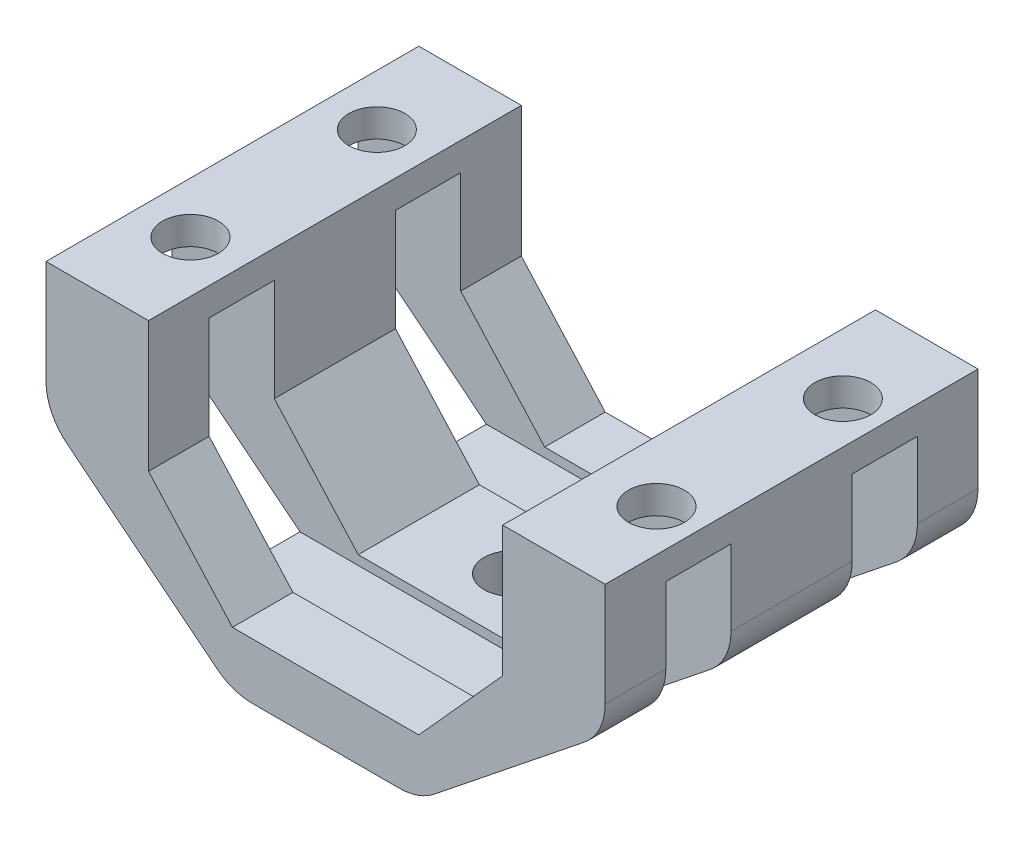
from build123d import *

# Parameters (mm, degrees)
SALIENTE_EXTRUIR1_DEPTH = 20
CROQUIS2_W              = 3.5
CROQUIS2_H              = 11
CORTAR_EXTRUIR3_DEPTH   = 37.932370625
CROQUIS3_R              = 1.5
CORTAR_EXTRUIR4_DEPTH   = 33.015621187
REDONDEO1_R             = 3
CROQUIS4_R              = 1.5
CORTAR_EXTRUIR5_DEPTH   = 31.724582991


with BuildPart() as part:
    # Croquis1 → Saliente-Extruir1 (new body)
    with BuildSketch(Plane.XY):
        Polygon((0, -5), (-4.5, 0), (-4.5, 7), (-10, 7), (-10, 0), (0, -8), (10, -8), (20, 0), (20, 7), (14.5, 7), (14.5, 0), (10, -5), align=None)
    extrude(amount=SALIENTE_EXTRUIR1_DEPTH)

    # Croquis2 → Cortar-Extruir3 (cut, through all)
    with BuildSketch(Plane.ZY.offset(10)):
        with Locations((15, 0)):
            Rectangle(CROQUIS2_W, CROQUIS2_H)
        with Locations((5, 0)):
            Rectangle(CROQUIS2_W, CROQUIS2_H)
    extrude(amount=-CORTAR_EXTRUIR3_DEPTH, mode=Mode.SUBTRACT)

    # Croquis3 → Cortar-Extruir4 (cut, through all)
    with BuildSketch(Plane(origin=(0, 7, 0), x_dir=(1, 0, 0), z_dir=(0, 1, 0))):
        with Locations((-7.25, -5)):
            Circle(CROQUIS3_R)
        with Locations((17.75, -5)):
            Circle(CROQUIS3_R)
        with Locations((17.75, -15)):
            Circle(CROQUIS3_R)
        with Locations((-7.25, -15)):
            Circle(CROQUIS3_R)
    extrude(amount=-CORTAR_EXTRUIR4_DEPTH, mode=Mode.SUBTRACT)

    # Redondeo1
    redondeo1_edges = [part.edges().sort_by_distance(p)[0] for p in [
        (10, -8, 10),
        (20, 0, 1.625),
        (20, 0, 18.375),
        (20, 0, 10),
        (0, -8, 10),
        (-10, 0, 18.375),
        (-10, 0, 1.625),
        (-10, 0, 10),
    ]]
    fillet(redondeo1_edges, radius=REDONDEO1_R)

    # Croquis4 → Cortar-Extruir5 (cut, through all)
    with BuildSketch(Plane(origin=(0, -5, 0), x_dir=(1, 0, 0), z_dir=(0, 1, 0))):
        with Locations((5, -10)):
            Circle(CROQUIS4_R)
    extrude(amount=-CORTAR_EXTRUIR5_DEPTH, mode=Mode.SUBTRACT)


solid = part.part
